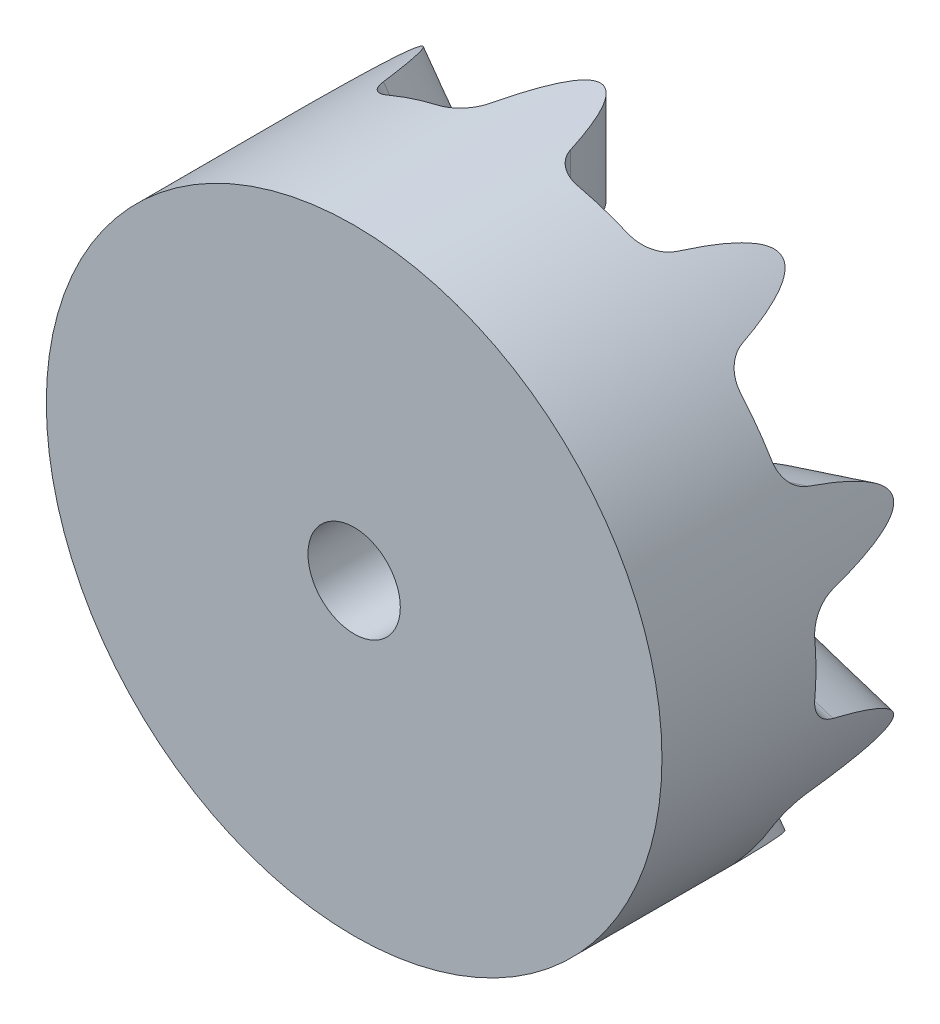
from build123d import *

# Parameters (mm, degrees)
SKETCH_1_W               = 1
SKETCH_1_H               = 5
SKETCH_1_W_2             = 3
SKETCH_1_W_3             = 6
SKETCH_1_4_W             = 3
SKETCH_1_4_H             = 3
EXTRUDE_2_DEPTH          = 25
FILLET_1_R               = 1
PATTERN_CIRCULAR_5_COUNT = 10
SKETCH_5_R               = 1.5
CUT_EXTRUDE_1_DEPTH      = 25


with BuildPart() as part:
    # ｽｹｯﾁ1 → 回転2 (revolve)
    with BuildSketch(Plane(origin=(0, 0, 0), x_dir=(1, 0, 0), z_dir=(0, 1, 0))):
        with Locations((6.5, 2.5)):
            Rectangle(SKETCH_1_W, SKETCH_1_H)
        with Locations((8.5, 2.5)):
            Rectangle(SKETCH_1_W_2, SKETCH_1_H)
        with Locations((3, 2.5)):
            Rectangle(SKETCH_1_W_3, SKETCH_1_H)
    revolve(axis=Axis((0, 0, 0), (0, 0, -1)))


with BuildPart() as body_2:
    # ｽｹｯﾁ1<4> → 回転3 (revolve)
    with BuildSketch(Plane(origin=(0, 0, 0), x_dir=(1, 0, 0), z_dir=(0, 1, 0))):
        with Locations((8.5, 6.5)):
            Rectangle(SKETCH_1_4_W, SKETCH_1_4_H)
    revolve(axis=Axis((0, 0, 0), (0, 0, -1)))


with BuildPart() as body_3:
    # ｽｹｯﾁ3 → ﾎﾞｽ - 押し出し2 (new body)
    with BuildSketch(Plane(origin=(0, 0, 0), x_dir=(1, 0, 0), z_dir=(0, 1, 0))):
        with BuildLine():
            Line((-1.5, 5), (1.5, 5))
            add(Edge.make_bspline(
                [(-1.5, 5), (0, 11), (1.5, 5)],
                knots=[0, 0, 0, 1, 1, 1], degree=2))
        make_face()
    extrude(amount=EXTRUDE_2_DEPTH)


with BuildPart() as body_2_1:
    add(body_2.part)

    # 交差1: read off the stored shape, not the designer's step
    # 交差1: intersect body 3
    add(body_3.part, mode=Mode.INTERSECT)


with BuildPart() as part_1:
    add(part.part)

    # Combine 1: union body 2
    add(body_2_1.part)

    # ﾌｨﾚｯﾄ1
    # the kernel refuses this fillet: 1 mm, written as the material it adds along each edge
    with BuildSketch(Plane(origin=(1.5, 4.918197807, -5), x_dir=(1, 0, 0), z_dir=(0, 1, 0))) as fillet_1_piece_1_section:
        with BuildLine():
            CenterArc((0.767679744, 1), FILLET_1_R, 196.014990867, 73.985009133)
            Line((-0.193509802, 0.724111149), (-0.212733593, 0.718593372))
            ThreePointArc((-0.212733593, 0.718593372), (-0.112969131, 0.357732105), (-0.01940285, -0.004850713))
            Line((-0.01940285, -0.004850713), (0, -0.02))
            Line((0, -0.02), (0.767679744, -0.02))
            Line((0.767679744, -0.02), (0.767679744, 0))
        make_face()
    fillet_1_piece_1 = extrude(amount=6.887861519, mode=Mode.PRIVATE)
    fillet_1_piece_1 = fillet_1_piece_1 & Plane(origin=(0, 0, -5), x_dir=(1, 0, 0), z_dir=(0, 0, -1)) * Cylinder(10, 17, mode=Mode.PRIVATE)
    fillet_1_piece_1 = fillet_1_piece_1 - Plane(origin=(0, 0, -5), x_dir=(1, 0, 0), z_dir=(0, 0, 1)) * Cylinder(7, 17, mode=Mode.PRIVATE)
    add(fillet_1_piece_1)
    with BuildSketch(Plane(origin=(-1.5, 4.918197807, -5), x_dir=(-1, 0, 0), z_dir=(0, 1, 0))) as fillet_1_piece_2_section:
        with BuildLine():
            CenterArc((0.767679744, -1), FILLET_1_R, 90, 73.985009133)
            Line((-0.193509802, -0.724111149), (-0.212733593, -0.718593372))
            ThreePointArc((-0.212733593, -0.718593372), (-0.112969131, -0.357732105), (-0.01940285, 0.004850713))
            Line((-0.01940285, 0.004850713), (0, 0.02))
            Line((0, 0.02), (0.767679744, 0.02))
            Line((0.767679744, 0.02), (0.767679744, 0))
        make_face()
    fillet_1_piece_2 = extrude(amount=6.887861519, mode=Mode.PRIVATE)
    fillet_1_piece_2 = fillet_1_piece_2 - Plane(origin=(0, 0, -5), x_dir=(1, 0, 0), z_dir=(0, 0, 1)) * Cylinder(7, 17, mode=Mode.PRIVATE)
    fillet_1_piece_2 = fillet_1_piece_2 & Plane(origin=(0, 0, -5), x_dir=(1, 0, 0), z_dir=(0, 0, -1)) * Cylinder(10, 17, mode=Mode.PRIVATE)
    add(fillet_1_piece_2)


with BuildPart() as pattern_circular_5_1:
    # 円形ﾊﾟﾀｰﾝ5: pattern copy
    add(part_1.part.rotate(Axis((0, 0, -21), (0, 0, 1)), 1 * 360 / PATTERN_CIRCULAR_5_COUNT))


with BuildPart() as pattern_circular_5_2:
    # 円形ﾊﾟﾀｰﾝ5: pattern copy
    add(part_1.part.rotate(Axis((0, 0, -21), (0, 0, 1)), 2 * 360 / PATTERN_CIRCULAR_5_COUNT))


with BuildPart() as pattern_circular_5_3:
    # 円形ﾊﾟﾀｰﾝ5: pattern copy
    add(part_1.part.rotate(Axis((0, 0, -21), (0, 0, 1)), 3 * 360 / PATTERN_CIRCULAR_5_COUNT))


with BuildPart() as pattern_circular_5_4:
    # 円形ﾊﾟﾀｰﾝ5: pattern copy
    add(part_1.part.rotate(Axis((0, 0, -21), (0, 0, 1)), 4 * 360 / PATTERN_CIRCULAR_5_COUNT))


with BuildPart() as pattern_circular_5_5:
    # 円形ﾊﾟﾀｰﾝ5: pattern copy
    add(part_1.part.rotate(Axis((0, 0, -21), (0, 0, 1)), 5 * 360 / PATTERN_CIRCULAR_5_COUNT))


with BuildPart() as pattern_circular_5_6:
    # 円形ﾊﾟﾀｰﾝ5: pattern copy
    add(part_1.part.rotate(Axis((0, 0, -21), (0, 0, 1)), 6 * 360 / PATTERN_CIRCULAR_5_COUNT))


with BuildPart() as pattern_circular_5_7:
    # 円形ﾊﾟﾀｰﾝ5: pattern copy
    add(part_1.part.rotate(Axis((0, 0, -21), (0, 0, 1)), 7 * 360 / PATTERN_CIRCULAR_5_COUNT))


with BuildPart() as pattern_circular_5_8:
    # 円形ﾊﾟﾀｰﾝ5: pattern copy
    add(part_1.part.rotate(Axis((0, 0, -21), (0, 0, 1)), 8 * 360 / PATTERN_CIRCULAR_5_COUNT))


with BuildPart() as pattern_circular_5_9:
    # 円形ﾊﾟﾀｰﾝ5: pattern copy
    add(part_1.part.rotate(Axis((0, 0, -21), (0, 0, 1)), 9 * 360 / PATTERN_CIRCULAR_5_COUNT))


with BuildPart() as part_2:
    add(part_1.part)

    # Combine 2: union 円形ﾊﾟﾀｰﾝ5_1, 円形ﾊﾟﾀｰﾝ5_2, 円形ﾊﾟﾀｰﾝ5_3, 円形ﾊﾟﾀｰﾝ5_4, 円形ﾊﾟﾀｰﾝ5_5, 円形ﾊﾟﾀｰﾝ5_6, 円形ﾊﾟﾀｰﾝ5_7, 円形ﾊﾟﾀｰﾝ5_8, 円形ﾊﾟﾀｰﾝ5_9
    add(pattern_circular_5_1.part)
    add(pattern_circular_5_2.part)
    add(pattern_circular_5_3.part)
    add(pattern_circular_5_4.part)
    add(pattern_circular_5_5.part)
    add(pattern_circular_5_6.part)
    add(pattern_circular_5_7.part)
    add(pattern_circular_5_8.part)
    add(pattern_circular_5_9.part)

    # ｽｹｯﾁ5 → ｶｯﾄ - 押し出し1 (cut)
    with BuildSketch(Plane(origin=(0, 0, -5), x_dir=(-1, 0, 0), z_dir=(0, 0, -1))):
        Circle(SKETCH_5_R)
    extrude(amount=-CUT_EXTRUDE_1_DEPTH, mode=Mode.SUBTRACT)


solid = part_2.part
